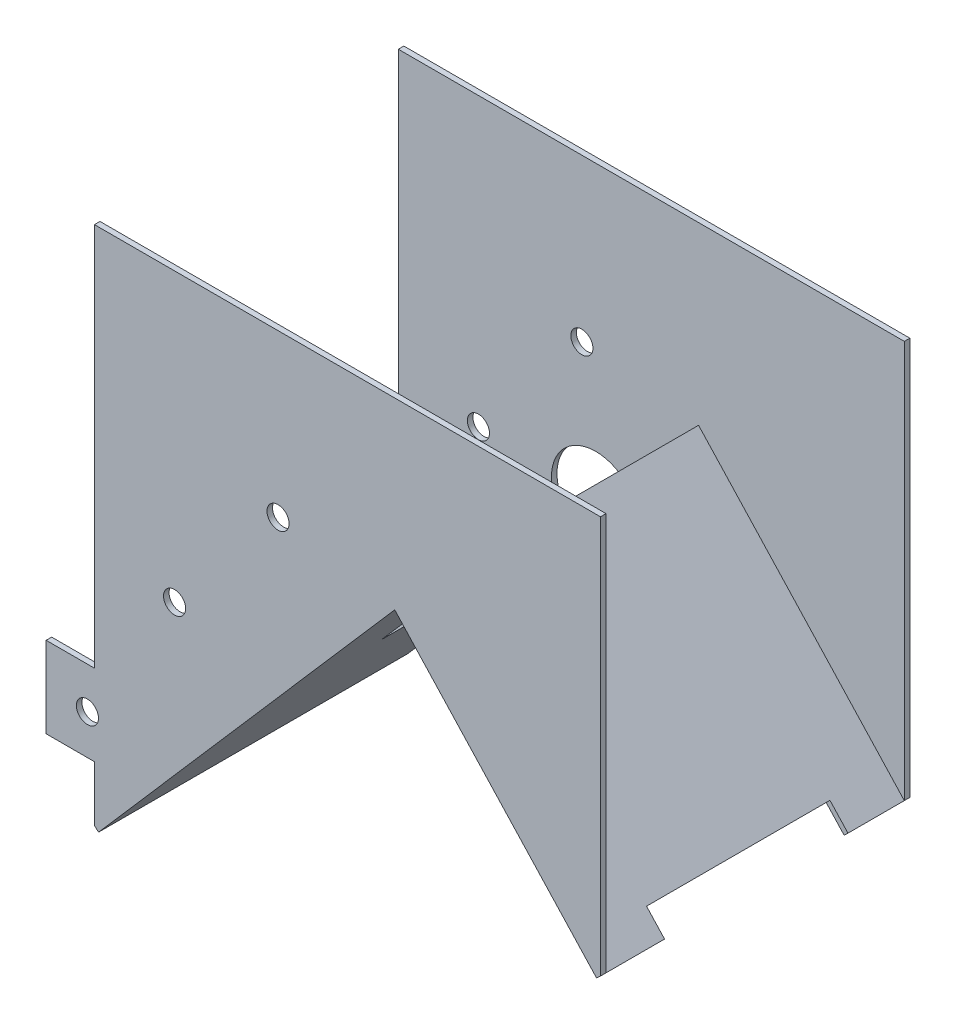
from build123d import *
from build123d.topology import SkipClean

# Parameters (mm, degrees)
BOSS_EXTRUDE1_DEPTH    = 177.8
SKETCH2_R              = 6.35
BOSS_EXTRUDE2_DEPTH    = 3.175
CUT_EXTRUDE1_START     = -3.175
CUT_EXTRUDE1_OUTLINE_W = 50.8
CUT_EXTRUDE1_OUTLINE_H = 108.585
CUT_EXTRUDE1_DEPTH     = 3.175
SKETCH4_R              = 25.4
CUT_EXTRUDE2_DEPTH     = 5.08
BOSS_EXTRUDE3_DEPTH    = 3.175
BOSS_EXTRUDE4_START    = -3.175
BOSS_EXTRUDE4_DEPTH    = 3.175
SKETCH2_3_R            = 6.35
CUT_EXTRUDE3_DEPTH     = 203.2
SKETCH7_W              = 105.41
SKETCH7_H              = 15.24
CUT_EXTRUDE4_DEPTH     = 3.175


# Read off the part's stored shape, not the designer's step: Cut-Extrude1
with BuildPart() as part:
    # Sketch1 → Boss-Extrude1 (new body)
    with BuildSketch(Plane.XY):
        Polygon((174.215968213, 205.236242664), (176.61217113, 203.153255247), (6.420733494, 7.37040221), (4.024530577, 9.453389627), align=None)
        Polygon((176.61217113, 203.153255247), (176.61217113, 207.680393207), (174.215968213, 205.236242664), align=None)
        Polygon((176.61217113, 203.153255247), (176.61217113, 207.680393207), (294.86623267, 79.97762329), (292.609334988, 77.887713122), align=None)
    extrude(amount=BOSS_EXTRUDE1_DEPTH)

    # Sketch2 → Boss-Extrude2 (add)
    with BuildSketch(Plane(origin=(0, 0, 0), x_dir=(-1, 0, 0), z_dir=(0, 0, -1))):
        Polygon((-176.61217113, 207.680393207), (-294.86623267, 79.97762329), (-294.86623267, 308.57762329), (-4.03623267, 308.57762329), (-4.03623267, 9.466851346), align=None)
        with Locations((-109.551832016, 215.6073789)):
            Circle(SKETCH2_R, mode=Mode.SUBTRACT)
        with Locations((-50.099162461, 143.63835786)):
            Circle(SKETCH2_R, mode=Mode.SUBTRACT)
    boss_extrude2 = extrude(amount=-BOSS_EXTRUDE2_DEPTH)

    # Mirror1: Boss-Extrude2 across plane
    add(boss_extrude2.mirror(Plane.XY.offset(88.9)))

    # Cut-Extrude1 outline → Cut-Extrude1 (cut)
    with BuildSketch(Plane(origin=(-2.388376456, 2.076183978, 0), x_dir=(0.6560590289905027, 0.754709580222776, 0), z_dir=(-0.754709580222776, 0.6560590289905027, 0)).offset(CUT_EXTRUDE1_START)):
        with Locations((182.49489334, -57.4675)):
            Rectangle(CUT_EXTRUDE1_OUTLINE_W, CUT_EXTRUDE1_OUTLINE_H)
    extrude(amount=CUT_EXTRUDE1_DEPTH, mode=Mode.SUBTRACT)

    # Sketch4 → Cut-Extrude2 (cut)
    with BuildSketch(Plane.XY.offset(3.175)):
        with Locations((117.470149606, 139.752328242)):
            Circle(SKETCH4_R)
    extrude(amount=-CUT_EXTRUDE2_DEPTH, mode=Mode.SUBTRACT)

    # Sketch5 → Boss-Extrude3 (add)
    with BuildSketch(Plane(origin=(0, 0, 0), x_dir=(-1, 0, 0), z_dir=(0, 0, -1))):
        with BuildLine():
            Line((23.718677813, 87.809342908), (-4.03623267, 87.809342908))
            Line((-4.03623267, 87.809342908), (-4.03623267, 68.97229904))
            ThreePointArc((-4.03623267, 68.97229904), (2.710389506, 69.812621892), (6.35, 64.070123417))
            ThreePointArc((6.35, 64.070123417), (2.710389506, 58.327624943), (-4.03623267, 59.167947795))
            Line((-4.03623267, 59.167947795), (-4.03623267, 41.258157594))
            Line((-4.03623267, 41.258157594), (23.718677813, 41.258157594))
            Line((23.718677813, 41.258157594), (23.718677813, 87.809342908))
        make_face()
    extrude(amount=-BOSS_EXTRUDE3_DEPTH)

    # Sketch6 → Boss-Extrude4 (add)
    with BuildSketch(Plane.XY.offset(177.8).offset(BOSS_EXTRUDE4_START)):
        with BuildLine():
            Line((4.03623267, 68.97229904), (4.03623267, 87.809342908))
            Line((4.03623267, 87.809342908), (-23.718677813, 87.809342908))
            Line((-23.718677813, 87.809342908), (-23.718677813, 41.258157594))
            Line((-23.718677813, 41.258157594), (4.03623267, 41.258157594))
            Line((4.03623267, 41.258157594), (4.03623267, 59.167947795))
            ThreePointArc((4.03623267, 59.167947795), (-6.35, 64.070123417), (4.03623267, 68.97229904))
        make_face()
    extrude(amount=BOSS_EXTRUDE4_DEPTH)

    # Sketch2<3> → Cut-Extrude3 (cut)
    with SkipClean():  # the faces are left unmerged after this step: merging them gives an invalid solid
        with BuildSketch(Plane(origin=(0, 0, 0), x_dir=(-1, 0, 0), z_dir=(0, 0, -1))):
            with Locations((0, 64.070123417)):
                Circle(SKETCH2_3_R)
        extrude(amount=-CUT_EXTRUDE3_DEPTH, mode=Mode.SUBTRACT)

    # Sketch7 → Cut-Extrude4 (cut)
    with SkipClean():  # the faces are left unmerged after this step: merging them gives an invalid solid
        with BuildSketch(Plane(origin=(198.614996443, 183.919503291, 0), x_dir=(0, 0, -1), z_dir=(0.7337298645028701, 0.6794413042615234, 0))):
            with Locations((-88.265, -134.042327008)):
                Rectangle(SKETCH7_W, SKETCH7_H)
        extrude(amount=-CUT_EXTRUDE4_DEPTH, mode=Mode.SUBTRACT)


solid = part.part
